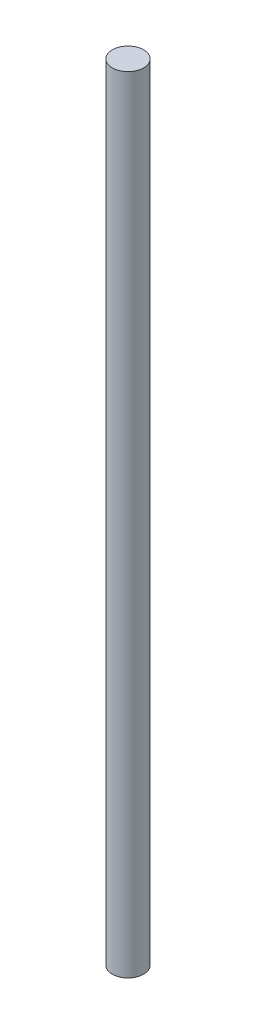
from build123d import *

# Parameters (mm, degrees)
SKETCH1_R           = 6
BOSS_EXTRUDE1_DEPTH = 300


with BuildPart() as part:
    # Sketch1 → Boss-Extrude1 (new body)
    with BuildSketch(Plane(origin=(0, 0, 0), x_dir=(1, 0, 0), z_dir=(0, 1, 0))):
        Circle(SKETCH1_R)
    extrude(amount=BOSS_EXTRUDE1_DEPTH)


solid = part.part
